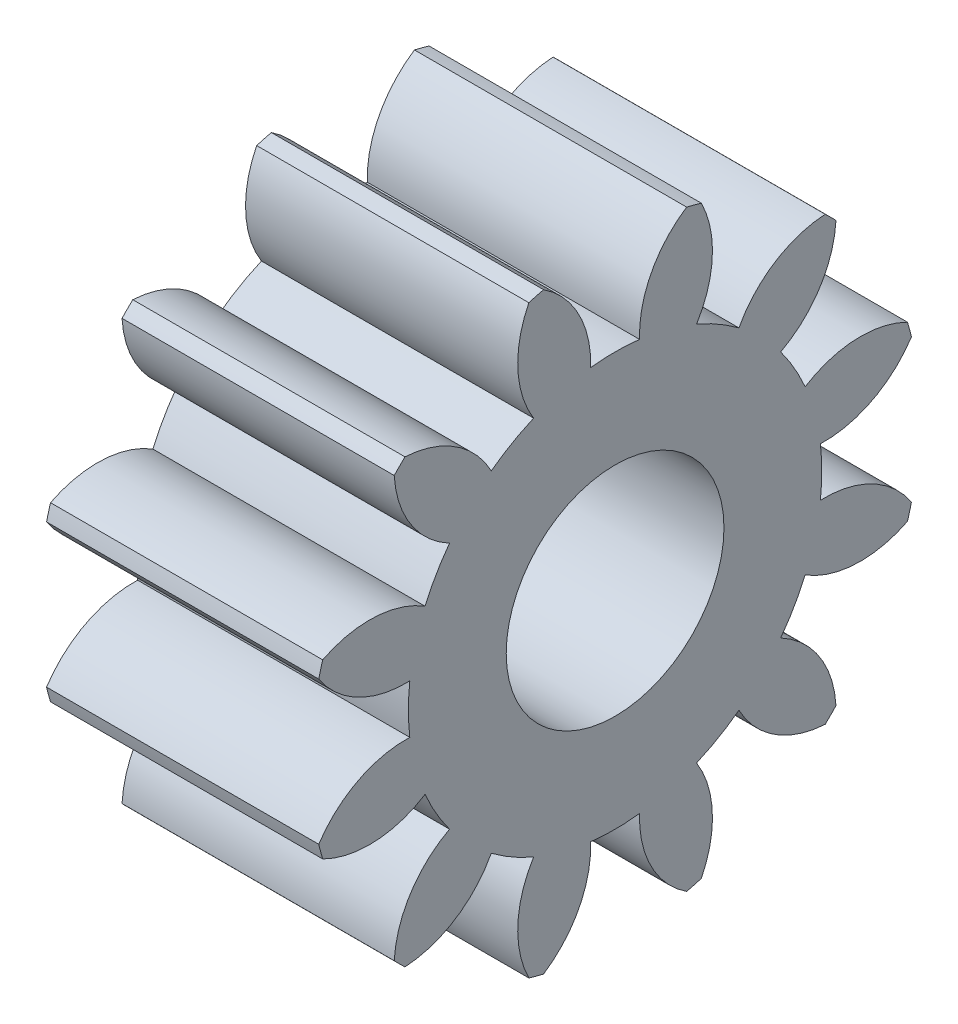
from build123d import *

# Parameters (mm, degrees)
BASPROSKE_W     = 2.5
BASPROSKE_H     = 2.8
TOOTHCUT_DEPTH  = 5.68294779
TEETHCUTS_COUNT = 12
TEETHCUTS_ANGLE = 330
BORSKE_R        = 1
BORE_DEPTH      = 50.0000508


with BuildPart() as part:
    # BasProSke → Base-Revolve (revolve)
    with BuildSketch(Plane(origin=(0, 0, 0), x_dir=(1, 0, 0), z_dir=(0, 1, 0))):
        with Locations((1.25, 1.4)):
            Rectangle(BASPROSKE_W, BASPROSKE_H)
    revolve(axis=Axis((-10, 0, 0), (1, 0, 0)))

    # TooCutSke → ToothCut (cut, through all)
    with BuildSketch(Plane(origin=(0, 0, 0), x_dir=(0, 0, -1), z_dir=(1, 0, 0))):
        with BuildLine():
            ThreePointArc((0.224627026, 1.885667972), (0, 1.899), (-0.224627026, 1.885667972))
            ThreePointArc((-0.224627026, 1.885667972), (-0.339529641, 2.375971187), (-0.686817046, 2.740650927))
            ThreePointArc((-0.686817046, 2.740650927), (0, 2.8254), (0.686817046, 2.740650927))
            ThreePointArc((0.686817046, 2.740650927), (0.339529641, 2.375971187), (0.224627026, 1.885667972))
        make_face()
    toothcut = extrude(amount=TOOTHCUT_DEPTH, mode=Mode.SUBTRACT)

    # TeethCuts: ToothCut ×12 about axis
    teethcuts_axis = Axis((-10, 0, 0), (1, 0, 0))
    for i in range(1, TEETHCUTS_COUNT):
        add(toothcut.rotate(teethcuts_axis, i * TEETHCUTS_ANGLE / (TEETHCUTS_COUNT - 1)), mode=Mode.SUBTRACT)

    # BorSke → Bore (cut, symmetric)
    with BuildSketch(Plane(origin=(0, 0, 0), x_dir=(0, 0, -1), z_dir=(1, 0, 0))):
        Circle(BORSKE_R)
    extrude(amount=BORE_DEPTH, both=True, mode=Mode.SUBTRACT)


solid = part.part
